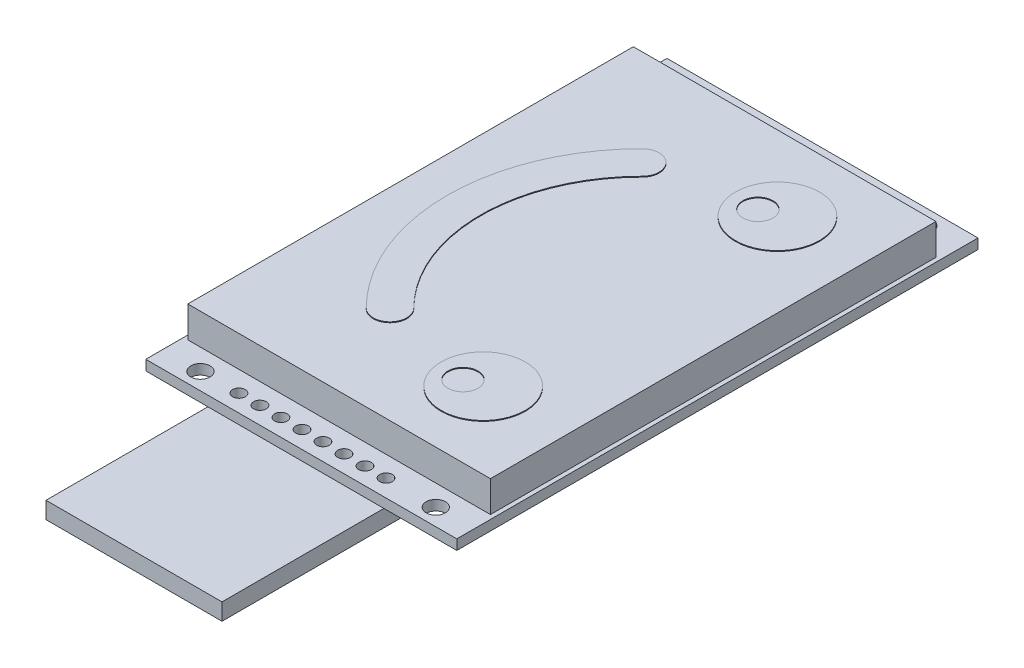
from build123d import *

# Parameters (mm, degrees)
SKETCH1_W           = 37
SKETCH1_H           = 62
SKETCH1_R           = 1.15
BOSS_EXTRUDE1_DEPTH = 1.2
SKETCH2_W           = 36
SKETCH2_H           = 53
BOSS_EXTRUDE2_DEPTH = 3.7
SKETCH3_R           = 0.75
CUT_EXTRUDE1_DEPTH  = 73.295850503
SKETCH4_R           = 5
SKETCH4_R_2         = 1.786053174
BOSS_EXTRUDE3_DEPTH = 0.1
SKETCH5_W           = 20.937122204
SKETCH5_H           = 23.749430493
BOSS_EXTRUDE4_DEPTH = 2


with BuildPart() as part:
    # Sketch1 → Boss-Extrude1 (new body)
    with BuildSketch(Plane(origin=(0, 0, 0), x_dir=(1, 0, 0), z_dir=(0, 1, 0))):
        with Locations((18.5, 31)):
            Rectangle(SKETCH1_W, SKETCH1_H)
        with Locations((32.5, 60)):
            Circle(SKETCH1_R, mode=Mode.SUBTRACT)
        with Locations((4.5, 60)):
            Circle(SKETCH1_R, mode=Mode.SUBTRACT)
        with Locations((32.5, 2)):
            Circle(SKETCH1_R, mode=Mode.SUBTRACT)
        with Locations((4.5, 2)):
            Circle(SKETCH1_R, mode=Mode.SUBTRACT)
    extrude(amount=BOSS_EXTRUDE1_DEPTH)

    # Sketch2 → Boss-Extrude2 (add)
    with BuildSketch(Plane(origin=(0, 1.2, 0), x_dir=(1, 0, 0), z_dir=(0, 1, 0))):
        with Locations((18.5, 31)):
            Rectangle(SKETCH2_W, SKETCH2_H)
    extrude(amount=BOSS_EXTRUDE2_DEPTH)

    # Sketch3 → Cut-Extrude1 (cut, through all)
    with BuildSketch(Plane(origin=(0, 1.2, 0), x_dir=(1, 0, 0), z_dir=(0, 1, 0))):
        with Locations((9.031578358, 2.050688375)):
            Circle(SKETCH3_R)
        with Locations((11.531578358, 2.050688375)):
            Circle(SKETCH3_R)
        with Locations((14.031578358, 2.050688375)):
            Circle(SKETCH3_R)
        with Locations((16.531578358, 2.050688375)):
            Circle(SKETCH3_R)
        with Locations((19.031578358, 2.050688375)):
            Circle(SKETCH3_R)
        with Locations((21.531578358, 2.050688375)):
            Circle(SKETCH3_R)
        with Locations((24.031578358, 2.050688375)):
            Circle(SKETCH3_R)
        with Locations((26.531578358, 2.050688375)):
            Circle(SKETCH3_R)
    extrude(amount=-CUT_EXTRUDE1_DEPTH, mode=Mode.SUBTRACT)

    # Sketch4 → Boss-Extrude3 (add)
    # profile 1 of 3: a face of its own
    with BuildSketch(Plane(origin=(0, 4.9, 0), x_dir=(1, 0, 0), z_dir=(0, 1, 0))):
        with Locations((26.639884222, 48.5)):
            Circle(SKETCH4_R)
        with Locations((24.763300075, 48.058155317)):
            Circle(SKETCH4_R_2, mode=Mode.SUBTRACT)
    # profile 2 of 3: a face of its own
    with BuildSketch(Plane(origin=(0, 4.9, 0), x_dir=(1, 0, 0), z_dir=(0, 1, 0))):
        with Locations((26.639884222, 13.5)):
            Circle(SKETCH4_R)
        with Locations((24.763300075, 12.971685579)):
            Circle(SKETCH4_R_2, mode=Mode.SUBTRACT)
    # profile 3 of 3: a face of its own
    with BuildSketch(Plane(origin=(0, 4.9, 0), x_dir=(1, 0, 0), z_dir=(0, 1, 0))):
        with BuildLine():
            ThreePointArc((11.640146641, 47.414213562), (4.841156768, 31), (11.640146641, 14.585786438))
            ThreePointArc((11.640146641, 14.585786438), (14.468573766, 14.585786438), (14.468573766, 17.414213562))
            ThreePointArc((14.468573766, 17.414213562), (8.841156768, 31), (14.468573766, 44.585786438))
            ThreePointArc((14.468573766, 44.585786438), (14.468573766, 47.414213562), (11.640146641, 47.414213562))
        make_face()
    extrude(amount=BOSS_EXTRUDE3_DEPTH)

    # Sketch5 → Boss-Extrude4 (add)
    with BuildSketch(Plane.XZ):
        with Locations((17.860565838, 7.383650804)):
            Rectangle(SKETCH5_W, SKETCH5_H)
    extrude(amount=BOSS_EXTRUDE4_DEPTH)


solid = part.part
